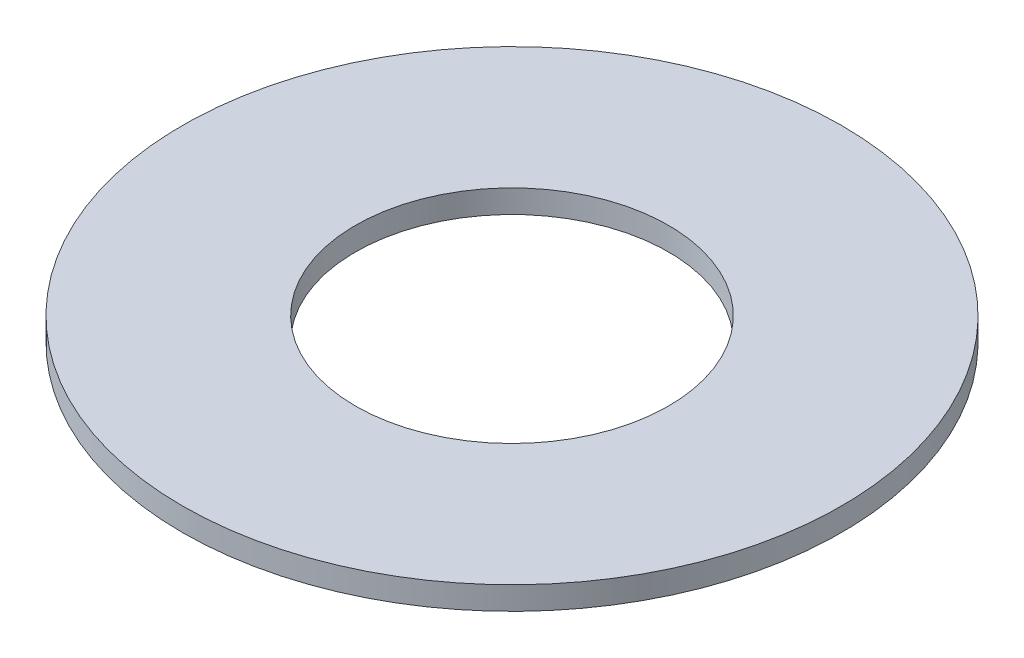
from build123d import *

# Parameters (mm, degrees)
SKETCH1_R           = 100
BOSS_EXTRUDE1_DEPTH = 7
SKETCH2_R           = 47.5
CUT_EXTRUDE1_DEPTH  = 142.594491418


with BuildPart() as part:
    # Sketch1 → Boss-Extrude1 (new body)
    with BuildSketch(Plane(origin=(0, 0, 0), x_dir=(1, 0, 0), z_dir=(0, 1, 0))):
        Circle(SKETCH1_R)
    extrude(amount=BOSS_EXTRUDE1_DEPTH)

    # Sketch2 → Cut-Extrude1 (cut, through all)
    with BuildSketch(Plane(origin=(0, 0, 0), x_dir=(1, 0, 0), z_dir=(0, 1, 0))):
        Circle(SKETCH2_R)
    extrude(amount=CUT_EXTRUDE1_DEPTH, mode=Mode.SUBTRACT)


solid = part.part
